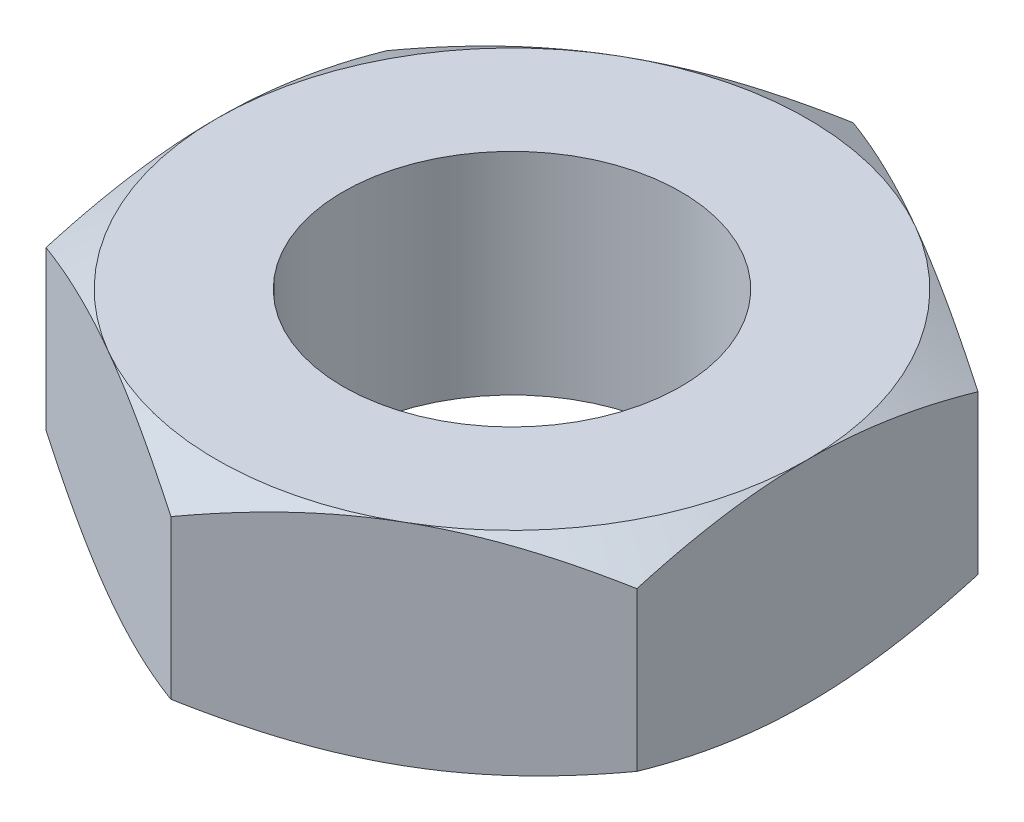
from build123d import *

# Parameters (mm, degrees)
SKETCH1_R               = 3.175
BOSS_EXTRUDE1_DEPTH     = 1.984375
SKETCH5_OUTSIDE_W       = 52.52
SKETCH5_OUTSIDE_H       = 54.24
SKETCH5_OUTSIDE_R       = 5.55625
CUT_EXTRUDE2_DEPTH      = 10.369388598
CUT_EXTRUDE2_DRAFT      = -60
MIRROR1_COPY_1_SKETCH_W = 52.52
MIRROR1_COPY_1_SKETCH_H = 54.24
MIRROR1_COPY_1_SKETCH_R = 5.55625
MIRROR1_COPY_1_DEPTH    = 10.369388598
MIRROR1_COPY_1_DRAFT    = -60


with BuildPart() as part:
    # Sketch1 → Boss-Extrude1 (new, symmetric)
    with BuildSketch(Plane(origin=(0, 0, 0), x_dir=(1, 0, 0), z_dir=(0, 1, 0))):
        Polygon((-5.55625, 3.207902433), (-5.55625, -3.207902433), (0, -6.415804866), (5.55625, -3.207902433), (5.55625, 3.207902433), (0, 6.415804866), align=None)
        Circle(SKETCH1_R, mode=Mode.SUBTRACT)
    extrude(amount=BOSS_EXTRUDE1_DEPTH, both=True)


with BuildPart() as cut_extrude2_tool:
    # Sketch5 outside → Cut-Extrude2 (with draft: the straight prism first)
    with BuildSketch(Plane(origin=(0, 1.984375, 0), x_dir=(1, 0, 0), z_dir=(0, 1, 0))):
        Rectangle(SKETCH5_OUTSIDE_W, SKETCH5_OUTSIDE_H)
        Circle(SKETCH5_OUTSIDE_R, mode=Mode.SUBTRACT)
    extrude(amount=-CUT_EXTRUDE2_DEPTH)
    # Cut-Extrude2: the draft: its side faces are tilted about the plane it starts from
    cut_extrude2_sides = [cut_extrude2_tool.faces().sort_by_distance(p)[0] for p in [
        (0, -3.200319299, 27.12),
        (26.26, -3.200319299, 0),
        (0, -3.200319299, -27.12),
        (-26.26, -3.200319299, 0),
        (-5.55625, -3.200319299, 0),
    ]]
    draft(cut_extrude2_sides, Plane(origin=(0, 1.984375, 0), x_dir=(1, 0, 0), z_dir=(0, 1, 0)), CUT_EXTRUDE2_DRAFT)


with BuildPart() as part_1:
    add(part.part)

    # Cut-Extrude2: cut by cut_extrude2_tool
    add(cut_extrude2_tool.part, mode=Mode.SUBTRACT)


with BuildPart() as mirror1_copy_1_tool:
    # Mirror1 copy 1 sketch → Mirror1 copy 1 (with draft: the straight prism first)
    with BuildSketch(Plane.XZ.offset(1.984375)):
        Rectangle(MIRROR1_COPY_1_SKETCH_W, MIRROR1_COPY_1_SKETCH_H)
        Circle(MIRROR1_COPY_1_SKETCH_R, mode=Mode.SUBTRACT)
    extrude(amount=-MIRROR1_COPY_1_DEPTH)
    # Mirror1 copy 1: the draft: its side faces are tilted about the plane it starts from
    mirror1_copy_1_sides = [mirror1_copy_1_tool.faces().sort_by_distance(p)[0] for p in [
        (0, 3.200319299, 27.12),
        (26.26, 3.200319299, 0),
        (0, 3.200319299, -27.12),
        (-26.26, 3.200319299, 0),
        (-5.55625, 3.200319299, 0),
    ]]
    draft(mirror1_copy_1_sides, Plane.XZ.offset(1.984375), MIRROR1_COPY_1_DRAFT)


with BuildPart() as part_2:
    add(part_1.part)

    # Mirror1 copy 1: cut by mirror1_copy_1_tool
    add(mirror1_copy_1_tool.part, mode=Mode.SUBTRACT)


solid = part_2.part
